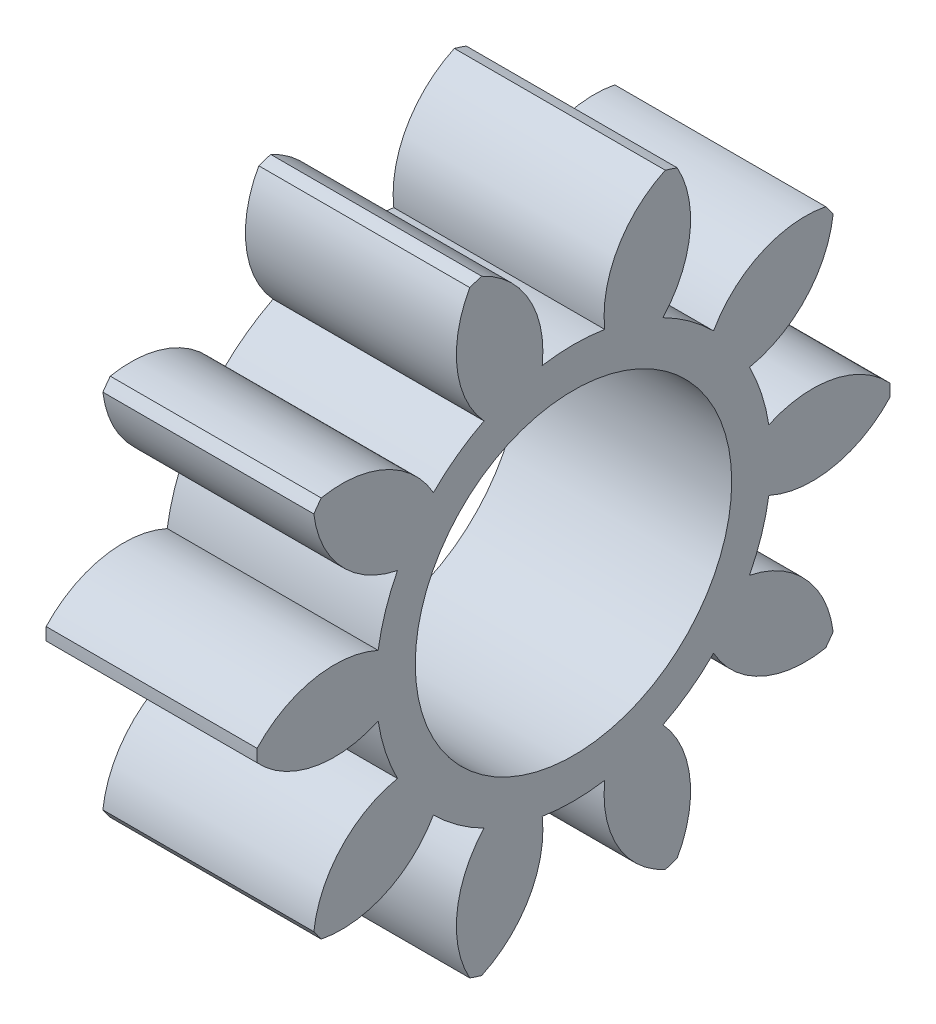
from build123d import *

# Parameters (mm, degrees)
BASPROSKE_W     = 4
BASPROSKE_H     = 6
TOOTHCUT_DEPTH  = 10.38083152
TEETHCUTS_COUNT = 10
TEETHCUTS_ANGLE = 324
BORSKE_R        = 3
BORE_DEPTH      = 50.0000508


with BuildPart() as part:
    # BasProSke → Base-Revolve (revolve)
    with BuildSketch(Plane(origin=(0, 0, 0), x_dir=(1, 0, 0), z_dir=(0, 1, 0))):
        with Locations((2, 3)):
            Rectangle(BASPROSKE_W, BASPROSKE_H)
    revolve(axis=Axis((-10, 0, 0), (1, 0, 0)))

    # TooCutSke → ToothCut (cut, through all)
    with BuildSketch(Plane(origin=(0, 0, 0), x_dir=(0, 0, -1), z_dir=(1, 0, 0))):
        with BuildLine():
            ThreePointArc((0.59278292, 3.701838653), (0, 3.749), (-0.59278292, 3.701838653))
            ThreePointArc((-0.59278292, 3.701838653), (-0.846593509, 4.924114224), (-1.775771316, 5.757784417))
            ThreePointArc((-1.775771316, 5.757784417), (0, 6.0254), (1.775771316, 5.757784417))
            ThreePointArc((1.775771316, 5.757784417), (0.846593509, 4.924114224), (0.59278292, 3.701838653))
        make_face()
    toothcut = extrude(amount=TOOTHCUT_DEPTH, mode=Mode.SUBTRACT)

    # TeethCuts: ToothCut ×10 about axis
    teethcuts_axis = Axis((-10, 0, 0), (1, 0, 0))
    for i in range(1, TEETHCUTS_COUNT):
        add(toothcut.rotate(teethcuts_axis, i * TEETHCUTS_ANGLE / (TEETHCUTS_COUNT - 1)), mode=Mode.SUBTRACT)

    # BorSke → Bore (cut, symmetric)
    with BuildSketch(Plane(origin=(0, 0, 0), x_dir=(0, 0, -1), z_dir=(1, 0, 0))):
        Circle(BORSKE_R)
    extrude(amount=BORE_DEPTH, both=True, mode=Mode.SUBTRACT)


solid = part.part
